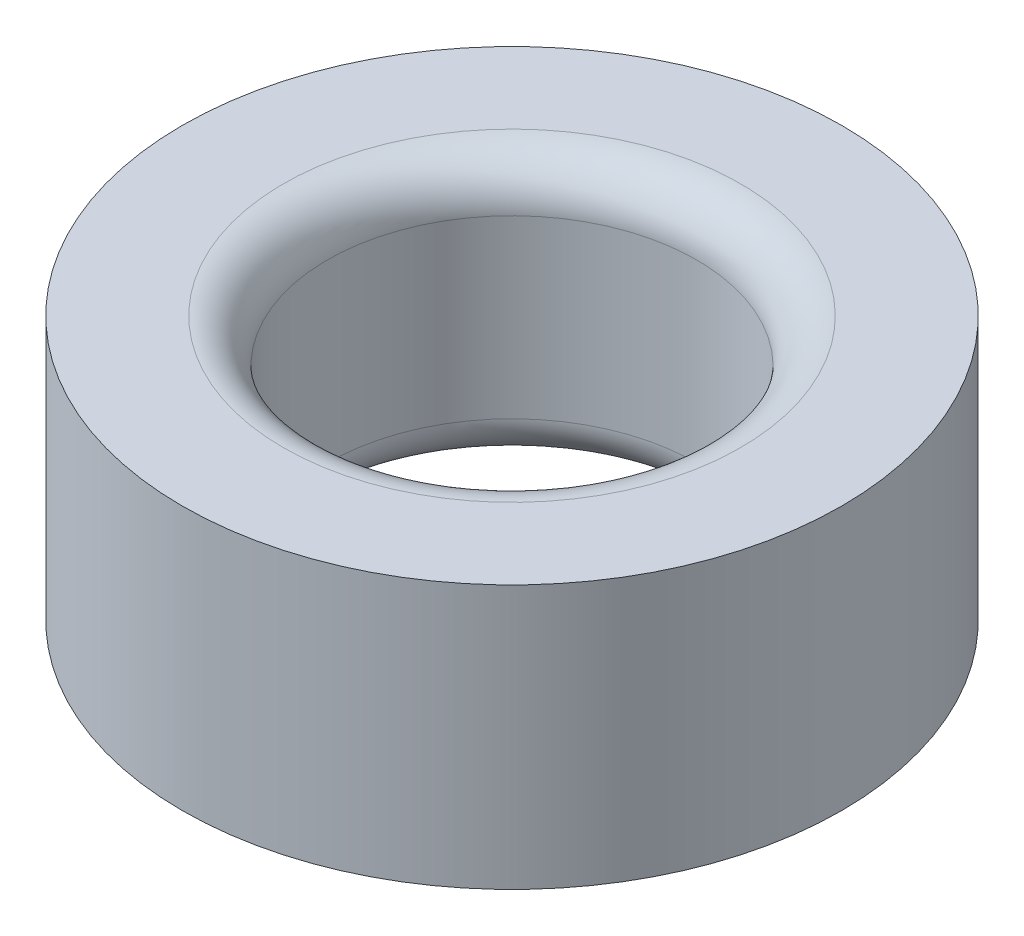
from build123d import *

# Parameters (mm, degrees)
SKETCH1_R           = 3.75
SKETCH1_R_2         = 2.1
BOSS_EXTRUDE1_DEPTH = 3
FILLET1_R           = 0.5


with BuildPart() as part:
    # Sketch1 → Boss-Extrude1 (new body)
    with BuildSketch(Plane(origin=(0, 0, 0), x_dir=(1, 0, 0), z_dir=(0, 1, 0))):
        Circle(SKETCH1_R)
        Circle(SKETCH1_R_2, mode=Mode.SUBTRACT)
    extrude(amount=BOSS_EXTRUDE1_DEPTH)

    # Fillet1
    fillet1_edges = [part.edges().sort_by_distance(p)[0] for p in [
        (-2.1, 0, 0),
        (-2.1, 3, 0),
    ]]
    fillet(fillet1_edges, radius=FILLET1_R)


solid = part.part
